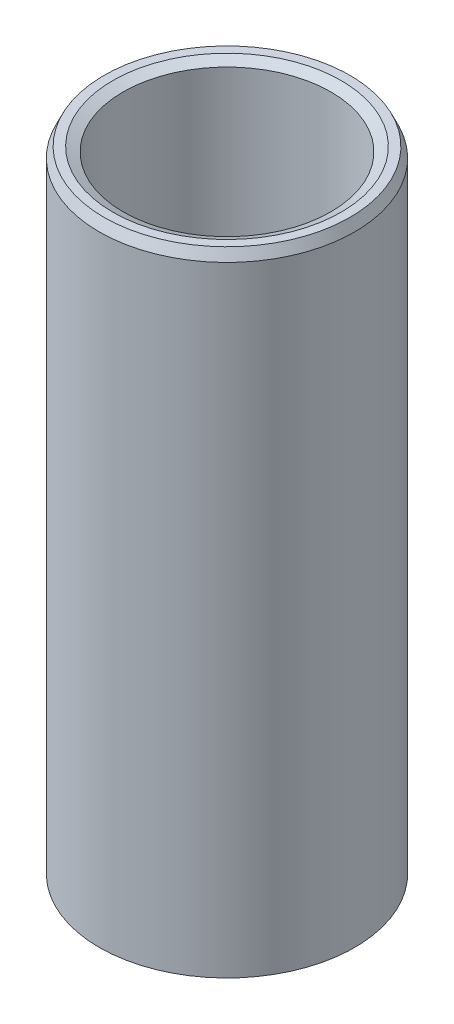
from build123d import *
from OCP.BRepFilletAPI import BRepFilletAPI_MakeChamfer

# Parameters (mm, degrees)
SKETCH1_R           = 25
BOSS_EXTRUDE1_DEPTH = 124.195019337
SKETCH2_R           = 20.33199376
CUT_EXTRUDE1_DEPTH  = 130.129403422
CHAMFER1_SIZE       = 1.998849585
CHAMFER1_SIZE2      = 0.932263152


with BuildPart() as part:
    # Sketch1 → Boss-Extrude1 (new body)
    with BuildSketch(Plane(origin=(0, 0, 0), x_dir=(1, 0, 0), z_dir=(0, 1, 0))):
        Circle(SKETCH1_R)
    extrude(amount=BOSS_EXTRUDE1_DEPTH)

    # Sketch2 → Cut-Extrude1 (cut, through all)
    with BuildSketch(Plane(origin=(0, 0, 0), x_dir=(1, 0, 0), z_dir=(0, 1, 0))):
        Circle(SKETCH2_R)
    extrude(amount=CUT_EXTRUDE1_DEPTH, mode=Mode.SUBTRACT)

    # Chamfer1: one chamfer whose edges measure the first distance from different faces: ONE call of the kernel's chamfer builder (chamfer() names one face for all edges)
    chamfer1_edges_1 = [part.edges().sort_by_distance(p)[0] for p in [
        (-20.33199376, 124.195019337, 0),
    ]]
    chamfer1_side_1 = [part.faces().sort_by_distance(p)[0] for p in [
        (-24.292893219, 124.195019337, 0),
    ]]
    chamfer1_edges_2 = [part.edges().sort_by_distance(p)[0] for p in [
        (-20.33199376, 0, 0),
    ]]
    chamfer1_side_2 = [part.faces().sort_by_distance(p)[0] for p in [
        (-20.33199376, 62.097509669, 0),
    ]]
    chamfer1_edges_3 = [part.edges().sort_by_distance(p)[0] for p in [
        (-25, 0, 0),
    ]]
    chamfer1_side_3 = [part.faces().sort_by_distance(p)[0] for p in [
        (-24.292893219, 0, 0),
    ]]
    chamfer1_edges_4 = [part.edges().sort_by_distance(p)[0] for p in [
        (-25, 124.195019337, 0),
    ]]
    chamfer1_side_4 = [part.faces().sort_by_distance(p)[0] for p in [
        (-25, 62.097509669, 0),
    ]]
    chamfer1 = BRepFilletAPI_MakeChamfer(part.part.solid().wrapped)
    for e in chamfer1_edges_1:
        chamfer1.Add(CHAMFER1_SIZE, CHAMFER1_SIZE2, e.wrapped, chamfer1_side_1[0].wrapped)  # the first distance lies on this face
    for e in chamfer1_edges_2:
        chamfer1.Add(CHAMFER1_SIZE, CHAMFER1_SIZE2, e.wrapped, chamfer1_side_2[0].wrapped)  # the first distance lies on this face
    for e in chamfer1_edges_3:
        chamfer1.Add(CHAMFER1_SIZE, CHAMFER1_SIZE2, e.wrapped, chamfer1_side_3[0].wrapped)  # the first distance lies on this face
    for e in chamfer1_edges_4:
        chamfer1.Add(CHAMFER1_SIZE, CHAMFER1_SIZE2, e.wrapped, chamfer1_side_4[0].wrapped)  # the first distance lies on this face
    add(Compound.cast(chamfer1.Shape()), mode=Mode.REPLACE)


solid = part.part
